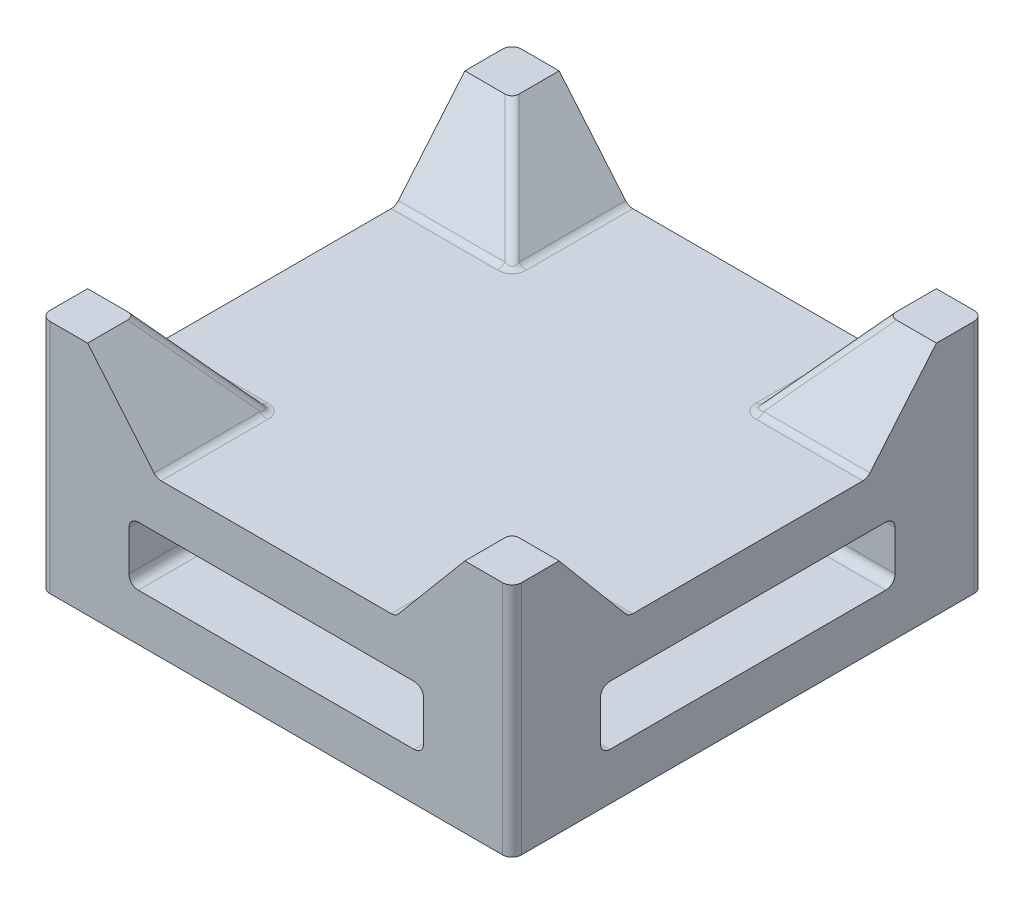
from build123d import *

# Parameters (mm, degrees)
SKETCH1_W               = 25.4
SKETCH1_H               = 25.4
BOSS_EXTRUDE1_DEPTH     = 12.7
CUT_EXTRUDE1_DEPTH      = 22.997045256
CUT_EXTRUDE1_DEPTH_BACK = 22.997045256
SKETCH2_W               = 15.875
SKETCH2_H               = 3.175
CUT_EXTRUDE2_DEPTH      = 22.997045256
CUT_EXTRUDE2_DEPTH_BACK = 22.997045256
SKETCH3_W               = 15.875
SKETCH3_H               = 3.175
BOSS_EXTRUDE2_DEPTH     = 3.175
BOSS_EXTRUDE3_REACH     = 23.997
FILLET1_R               = 1.27
FILLET2_R               = 0.508
FILLET3_R               = 0.762


with BuildPart() as part:
    # Sketch1 → Boss-Extrude1 (new body)
    with BuildSketch(Plane(origin=(0, 0, 0), x_dir=(1, 0, 0), z_dir=(0, 1, 0))):
        Rectangle(SKETCH1_W, SKETCH1_H)
    extrude(amount=BOSS_EXTRUDE1_DEPTH)

    # Sketch2 → Cut-Extrude1 (cut, two sides: drawn at the far end of the back side and taken through both)
    with BuildSketch(Plane.XY.offset(-CUT_EXTRUDE1_DEPTH_BACK)):
        Polygon((-10.16, 12.7), (-6.430202139, 8.255), (6.430202139, 8.255), (10.16, 12.7), align=None)
        with Locations((0, 4.1275)):
            Rectangle(SKETCH2_W, SKETCH2_H)
    extrude(amount=CUT_EXTRUDE1_DEPTH + CUT_EXTRUDE1_DEPTH_BACK, mode=Mode.SUBTRACT)

    # Sketch3 → Cut-Extrude2 (cut, two sides: drawn at the far end of the back side and taken through both)
    with BuildSketch(Plane(origin=(0, 0, 0), x_dir=(0, 0, -1), z_dir=(1, 0, 0)).offset(-CUT_EXTRUDE2_DEPTH_BACK)):
        Polygon((-10.16, 12.7), (-6.430202139, 8.255), (6.430202139, 8.255), (10.16, 12.7), align=None)
        with Locations((0, 4.1275)):
            Rectangle(SKETCH3_W, SKETCH3_H)
    extrude(amount=CUT_EXTRUDE2_DEPTH + CUT_EXTRUDE2_DEPTH_BACK, mode=Mode.SUBTRACT)


with BuildPart() as body_2:
    # Sketch4 → Boss-Extrude2 (new, symmetric)
    with BuildSketch(Plane.XY):
        Polygon((-6.35, -3.175), (6.35, -3.175), (6.35, -4.7625), (3.175, -7.9375), (-3.175, -7.9375), (-6.35, -4.7625), align=None)
    extrude(amount=BOSS_EXTRUDE2_DEPTH, both=True)

    # Sketch5 → Boss-Extrude3 (add, up to next)
    with BuildSketch(Plane.XZ, mode=Mode.PRIVATE) as boss_extrude3_sk1:
        with BuildLine():
            Line((3.175, -3.175), (0, -3.175))
            ThreePointArc((0, -3.175), (-2.24506403, -2.24506403), (-3.175, 0))
            Line((-3.175, 0), (-3.175, 3.175))
            Line((-3.175, 3.175), (0, 3.175))
            ThreePointArc((0, 3.175), (2.24506403, 2.24506403), (3.175, 0))
            Line((3.175, 0), (3.175, -3.175))
        make_face()
    boss_extrude3_tool1 = extrude(boss_extrude3_sk1.sketch, amount=BOSS_EXTRUDE3_REACH, mode=Mode.PRIVATE) - body_2.part

    add(part.part)  # Boss-Extrude3 merges part
    add(boss_extrude3_tool1.solids().sort_by_distance((0, 0, 0))[0])

    # Fillet1
    fillet1_edges = [body_2.edges().sort_by_distance(p)[0] for p in [
        (-7.9375, 4.1275, 7.9375),
        (7.9375, 4.1275, 7.9375),
        (-7.9375, 4.1275, -7.9375),
        (7.9375, 4.1275, -7.9375),
    ]]
    fillet(fillet1_edges, radius=FILLET1_R)

    # Fillet2
    fillet2_edges = [body_2.edges().sort_by_distance(p)[0] for p in [
        (7.9375, 5.715, 10.95375),
        (7.9375, 2.54, 10.95375),
        (10.95375, 5.715, 7.9375),
        (10.95375, 2.54, 7.9375),
        (10.95375, 2.54, -7.9375),
        (10.95375, 5.715, -7.9375),
        (-7.9375, 2.54, 10.95375),
        (-7.9375, 5.715, 10.95375),
        (8.309474388, 2.54, 8.309474388),
        (8.309474388, 5.715, 8.309474388),
        (8.309474388, 5.715, -8.309474388),
        (8.309474388, 2.54, -8.309474388),
        (-8.309474388, 2.54, -8.309474388),
        (-8.309474388, 5.715, -8.309474388),
        (-8.309474388, 5.715, 8.309474388),
        (-8.309474388, 2.54, 8.309474388),
        (6.430202139, 8.255, -9.56510107),
        (-6.430202139, 8.255, -9.56510107),
        (-7.9375, 2.54, -10.95375),
        (-7.9375, 5.715, -10.95375),
        (7.9375, 5.715, -10.95375),
        (7.9375, 2.54, -10.95375),
        (-6.430202139, 8.255, 9.56510107),
        (-8.29510107, 10.4775, 8.29510107),
        (-8.29510107, 10.4775, -8.29510107),
        (6.430202139, 8.255, 9.56510107),
        (-10.95375, 5.715, 7.9375),
        (-10.95375, 2.54, -7.9375),
        (-10.95375, 2.54, 7.9375),
        (-10.95375, 5.715, -7.9375),
        (8.29510107, 10.4775, -8.29510107),
        (9.56510107, 8.255, -6.430202139),
        (-9.56510107, 8.255, -6.430202139),
        (8.29510107, 10.4775, 8.29510107),
        (9.56510107, 8.255, 6.430202139),
        (-9.56510107, 8.255, 6.430202139),
        (-12.7, 6.35, -12.7),
        (12.7, 6.35, -12.7),
        (12.7, 6.35, 12.7),
        (-12.7, 6.35, 12.7),
    ]]
    fillet(fillet2_edges, radius=FILLET2_R)

    # Fillet3
    # the kernel refuses this fillet: 0.762 mm, written as the material it adds along each edge
    with BuildSketch(Plane(origin=(-3.175, -3.175, 0), x_dir=(0, 1, 0), z_dir=(0, 0, 1)), Plane(origin=(3.175, -3.175, 0), x_dir=(0, 1, 0), z_dir=(0, 0, -1)), Plane(origin=(3.175, 0, -3.175), x_dir=(0, 0, -1), z_dir=(-1, 0, 0)), Plane(origin=(3.175, 0, 0), x_dir=(1, 0, 0), z_dir=(0, 0, -1)), Plane(origin=(-3.175, 0, 0), x_dir=(-1, 0, 0), z_dir=(0, 0, 1)), Plane(origin=(-3.175, 0, 3.175), x_dir=(0, 0, 1), z_dir=(1, 0, 0))) as fillet3_piece_1:
        with BuildLine():
            CenterArc((FILLET3_R, FILLET3_R), FILLET3_R, 180, 90)
            Line((0, FILLET3_R), (0, 0))
            Line((0, 0), (FILLET3_R, 0))
        make_face()
    extrude(amount=3.175)
    with BuildSketch(Plane(origin=(0, -3.175, 0), x_dir=(0.8523223955917425, 0, -0.5230167626116329), z_dir=(0.5230167626116329, 0, 0.8523223955917425))) as fillet3_piece_2_section:
        with BuildLine():
            CenterArc((3.175 + FILLET3_R, FILLET3_R), FILLET3_R, 180, 90)
            Line((3.175 + FILLET3_R, 0), (3.175, 0))
            Line((3.175, 0), (3.175, FILLET3_R))
        make_face()
    fillet3_piece_2 = revolve(axis=Axis((0, -3.175, 0), (0, 1, 0)), revolution_arc=148.465171609, mode=Mode.PRIVATE)
    fillet3_piece_2 = split(fillet3_piece_2, bisect_by=Plane(origin=(0, -3.175, -3.175), z_dir=(0, 0, 1)), keep=Keep.TOP, mode=Mode.PRIVATE)
    add(fillet3_piece_2)
    with BuildSketch(Plane(origin=(0, -3.175, 0), x_dir=(-0.8523223955917423, 0, 0.5230167626116333), z_dir=(-0.5230167626116333, 0, -0.8523223955917423))) as fillet3_piece_3_section:
        with BuildLine():
            CenterArc((3.175 + FILLET3_R, FILLET3_R), FILLET3_R, 180, 90)
            Line((3.175 + FILLET3_R, 0), (3.175, 0))
            Line((3.175, 0), (3.175, FILLET3_R))
        make_face()
    fillet3_piece_3 = revolve(axis=Axis((0, -3.175, 0), (0, 1, 0)), revolution_arc=148.465171609, mode=Mode.PRIVATE)
    fillet3_piece_3 = split(fillet3_piece_3, bisect_by=Plane(origin=(0, -3.175, 3.175), z_dir=(0, 0, -1)), keep=Keep.TOP, mode=Mode.PRIVATE)
    add(fillet3_piece_3)
    with BuildSketch(Plane(origin=(0, 0, 0), x_dir=(0, 0, -1), z_dir=(1, 0, 0))) as fillet3_piece_4:
        with BuildLine():
            CenterArc((3.175 + FILLET3_R, -FILLET3_R), FILLET3_R, 90, 90)
            Line((3.175, -FILLET3_R), (3.175, 0))
            Line((3.175, 0), (3.175 + FILLET3_R, 0))
        make_face()
    revolve(axis=Axis((0, 0, 0), (0, 1, 0)), revolution_arc=90)
    with BuildSketch(Plane(origin=(0, 0, 0), x_dir=(0, 0, 1), z_dir=(-1, 0, 0))) as fillet3_piece_5:
        with BuildLine():
            CenterArc((3.175 + FILLET3_R, -FILLET3_R), FILLET3_R, 90, 90)
            Line((3.175, -FILLET3_R), (3.175, 0))
            Line((3.175, 0), (3.175 + FILLET3_R, 0))
        make_face()
    revolve(axis=Axis((0, 0, 0), (0, 1, 0)), revolution_arc=90)
    with BuildSketch(Plane(origin=(5.08, 0, -3.175), x_dir=(0, 0, -1), z_dir=(-1, 0, 0))) as fillet3_piece_6a_section:
        with BuildLine():
            CenterArc((FILLET3_R, FILLET3_R), FILLET3_R, 180, 90)
            Line((0, FILLET3_R), (0, 0))
            Line((0, 0), (FILLET3_R, 0))
        make_face()
    fillet3_piece_6a = extrude(amount=5.08, mode=Mode.PRIVATE)
    fillet3_piece_6a = split(fillet3_piece_6a, bisect_by=Plane(origin=(3.175, 0, -3.175), z_dir=(1, 0, 0)), keep=Keep.TOP, mode=Mode.PRIVATE)
    with BuildSketch(Plane(origin=(3.175, 0, 0), x_dir=(1, 0, 0), z_dir=(0, 0, -1))) as fillet3_piece_6b_section:
        with BuildLine():
            CenterArc((FILLET3_R, FILLET3_R), FILLET3_R, 180, 90)
            Line((0, FILLET3_R), (0, 0))
            Line((0, 0), (FILLET3_R, 0))
        make_face()
    fillet3_piece_6b = extrude(amount=5.08, mode=Mode.PRIVATE)
    fillet3_piece_6b = split(fillet3_piece_6b, bisect_by=Plane(origin=(3.175, 0, -3.175), z_dir=(0, 0, -1)), keep=Keep.TOP, mode=Mode.PRIVATE)
    fillet3_piece_6 = fillet3_piece_6a & fillet3_piece_6b
    add(fillet3_piece_6)
    with BuildSketch(Plane(origin=(-3.175, 0, 0), x_dir=(-1, 0, 0), z_dir=(0, 0, 1))) as fillet3_piece_7a_section:
        with BuildLine():
            CenterArc((FILLET3_R, FILLET3_R), FILLET3_R, 180, 90)
            Line((0, FILLET3_R), (0, 0))
            Line((0, 0), (FILLET3_R, 0))
        make_face()
    fillet3_piece_7a = extrude(amount=5.08, mode=Mode.PRIVATE)
    fillet3_piece_7a = split(fillet3_piece_7a, bisect_by=Plane(origin=(-3.175, 0, 3.175), z_dir=(0, 0, 1)), keep=Keep.TOP, mode=Mode.PRIVATE)
    with BuildSketch(Plane(origin=(-5.08, 0, 3.175), x_dir=(0, 0, 1), z_dir=(1, 0, 0))) as fillet3_piece_7b_section:
        with BuildLine():
            CenterArc((FILLET3_R, FILLET3_R), FILLET3_R, 180, 90)
            Line((0, FILLET3_R), (0, 0))
            Line((0, 0), (FILLET3_R, 0))
        make_face()
    fillet3_piece_7b = extrude(amount=5.08, mode=Mode.PRIVATE)
    fillet3_piece_7b = split(fillet3_piece_7b, bisect_by=Plane(origin=(-3.175, 0, 3.175), z_dir=(-1, 0, 0)), keep=Keep.TOP, mode=Mode.PRIVATE)
    fillet3_piece_7 = fillet3_piece_7a & fillet3_piece_7b
    add(fillet3_piece_7)


solid = body_2.part
